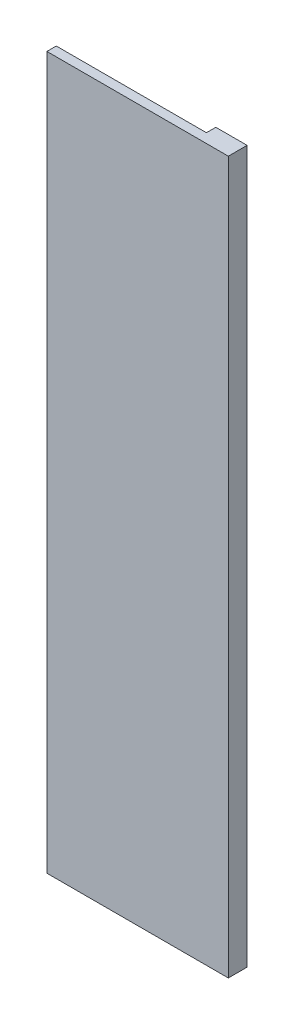
from build123d import *

# Parameters (mm, degrees)
BOSS_EXTRUDE1_DEPTH = 6
SKETCH2_W           = 116
SKETCH2_H           = 455
BOSS_EXTRUDE2_DEPTH = 6


with BuildPart() as part:
    # Sketch1 → Boss-Extrude1 (new body)
    with BuildSketch(Plane.XY):
        Polygon((68, 435), (48, 435), (48, 0), (-48, 0), (-48, -20), (68, -20), align=None)
    extrude(amount=-BOSS_EXTRUDE1_DEPTH)

    # Sketch2 → Boss-Extrude2 (add)
    with BuildSketch(Plane.XY):
        with Locations((10, 207.5)):
            Rectangle(SKETCH2_W, SKETCH2_H)
    extrude(amount=BOSS_EXTRUDE2_DEPTH)


solid = part.part
